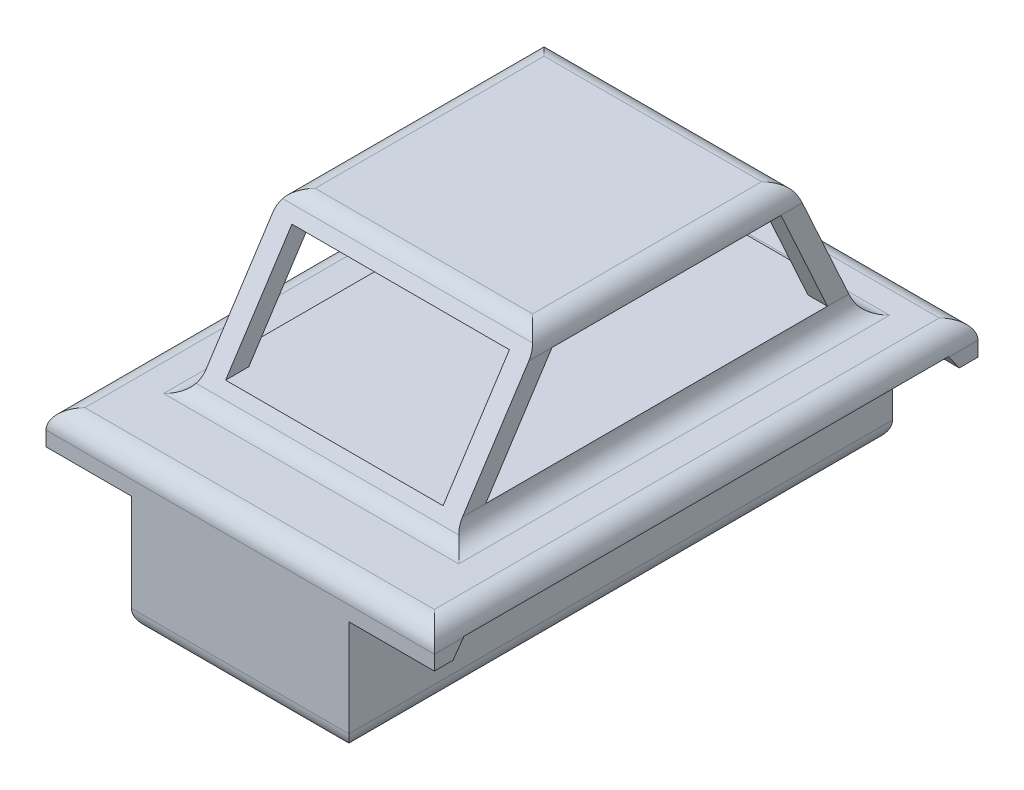
from build123d import *

# Parameters (mm, degrees)
SKETCH1_W           = 200
SKETCH1_H           = 150
BOSS_EXTRUDE1_DEPTH = 280
SKETCH2_W           = 44
SKETCH2_H           = 60
SKETCH2_W_2         = 34
SKETCH2_H_2         = 72.5
CUT_EXTRUDE1_DEPTH  = 280
CUT_EXTRUDE5_DEPTH  = 200
CUT_EXTRUDE8_DEPTH  = 44
CUT_EXTRUDE9_DEPTH  = 44
SKETCH6_W           = 112
SKETCH6_H           = 52.5
CUT_EXTRUDE7_DEPTH  = 280
FILLET1_START       = -100
FILLET1_DEPTH       = 200
FILLET1_START_2     = -76
FILLET1_2_DEPTH     = 10
FILLET1_START_3     = 66
FILLET1_3_DEPTH     = 10
FILLET1_START_4     = -66
FILLET1_4_DEPTH     = 132
FILLET1_START_5     = -281
FILLET1_5_DEPTH     = 282


with BuildPart() as part:
    # Sketch1 → Boss-Extrude1 (new body)
    with BuildSketch(Plane.XY):
        Rectangle(SKETCH1_W, SKETCH1_H)
    extrude(amount=-BOSS_EXTRUDE1_DEPTH)

    # Sketch2 → Cut-Extrude1 (cut)
    with BuildSketch(Plane.XY):
        with Locations((78, -45)):
            Rectangle(SKETCH2_W, SKETCH2_H)
        with Locations((-78, -45)):
            Rectangle(SKETCH2_W, SKETCH2_H)
        with Locations((83, 38.75)):
            Rectangle(SKETCH2_W_2, SKETCH2_H_2)
        with Locations((-83, 38.75)):
            Rectangle(SKETCH2_W_2, SKETCH2_H_2)
    extrude(amount=-CUT_EXTRUDE1_DEPTH, mode=Mode.SUBTRACT)

    # Sketch3 → Cut-Extrude5 (cut)
    with BuildSketch(Plane.ZY.offset(100)):
        Polygon((-280, 2.5), (-274.399041425, 2.5), (-252, 2.5), (-218.971094498, 75), (-280, 75), align=None)
        Polygon((-236.455453487, 12.5), (-168.766953205, 12.5), (-60.438488841, 12.5), (-94.602997447, 65), (-144.84946991, 65), (-212.537970192, 65), align=None)
        Polygon((-89.179559504, 75), (-42, 2.5), (-5.600958575, 2.5), (0, 2.5), (0, 75), align=None)
    extrude(amount=-CUT_EXTRUDE5_DEPTH, mode=Mode.SUBTRACT)

    # Sketch5 → Cut-Extrude8 (cut)
    with BuildSketch(Plane.ZY.offset(100)):
        Polygon((-264.773291637, -7.125749789), (-270.374250211, -15), (-140, -15), (-140, -7.125749789), align=None)
        Polygon((-15.226708363, -7.125749789), (-140, -7.125749789), (-140, -15), (-9.625749789, -15), align=None)
    extrude(amount=-CUT_EXTRUDE8_DEPTH, mode=Mode.SUBTRACT)

    # Sketch7 → Cut-Extrude9 (cut)
    with BuildSketch(Plane(origin=(100, 0, 0), x_dir=(0, 0, -1), z_dir=(1, 0, 0))):
        Polygon((9.625749789, -15), (15.226708363, -7.125749789), (264.773291637, -7.125749789), (270.374250211, -15), align=None)
    extrude(amount=-CUT_EXTRUDE9_DEPTH, mode=Mode.SUBTRACT)

    # Sketch6 → Cut-Extrude7 (cut)
    with BuildSketch(Plane.XY):
        with Locations((0, 38.75)):
            Rectangle(SKETCH6_W, SKETCH6_H)
    extrude(amount=-CUT_EXTRUDE7_DEPTH, mode=Mode.SUBTRACT)

    # Fillet1: read off the stored shape, not the designer's step
    # Fillet1 outline → Fillet1 (cut)
    with BuildSketch(Plane.YZ.offset(FILLET1_START)):
        with BuildLine():
            Line((-75, 0), (-75, -10))
            ThreePointArc((-75, -10), (-72.071067812, -2.928932188), (-65, 0))
            Line((-65, 0), (-75, 0))
        make_face()
        with BuildLine():
            ThreePointArc((-65, -280), (-72.071067812, -277.071067812), (-75, -270))
            Line((-75, -270), (-75, -280))
            Line((-75, -280), (-65, -280))
        make_face()
        with BuildLine():
            Line((2.5, 0), (-7.5, 0))
            ThreePointArc((-7.5, 0), (-0.428932188, -2.928932188), (2.5, -10))
            Line((2.5, -10), (2.5, 0))
        make_face()
        with BuildLine():
            ThreePointArc((2.5, -270), (-0.428932188, -277.071067812), (-7.5, -280))
            Line((-7.5, -280), (2.5, -280))
            Line((2.5, -280), (2.5, -270))
        make_face()
        with BuildLine():
            Line((75, -89.179559504), (70.454316835, -86.221444616))
            ThreePointArc((70.454316835, -86.221444616), (73.790425711, -89.835564613), (75, -94.602997447))
            Line((75, -94.602997447), (75, -89.179559504))
        make_face()
        with BuildLine():
            ThreePointArc((75, -212.537970192), (73.410042611, -217.948255145), (69.145763344, -221.638115591))
            Line((69.145763344, -221.638115591), (75, -218.971094498))
            Line((75, -218.971094498), (75, -212.537970192))
        make_face()
    extrude(amount=FILLET1_DEPTH, mode=Mode.SUBTRACT)

    # Fillet1 2 outline → Fillet1 2 (add)
    with BuildSketch(Plane.YZ.offset(FILLET1_START_2)):
        with BuildLine():
            ThreePointArc((7.045683165, -44.958114888), (3.709574289, -41.343994891), (2.5, -36.576562057))
            Line((2.5, -36.576562057), (2.5, -258.433124306))
            ThreePointArc((2.5, -258.433124306), (4.089957389, -253.022839352), (8.354236656, -249.332978906))
            Line((8.354236656, -249.332978906), (69.145763344, -221.638115591))
            ThreePointArc((69.145763344, -221.638115591), (73.410042611, -217.948255145), (75, -212.537970192))
            Line((75, -212.537970192), (75, -94.602997447))
            ThreePointArc((75, -94.602997447), (73.790425711, -89.835564613), (70.454316835, -86.221444616))
            Line((70.454316835, -86.221444616), (7.045683165, -44.958114888))
        make_face()
    extrude(amount=FILLET1_2_DEPTH)

    # Fillet1 3 outline → Fillet1 3 (add)
    with BuildSketch(Plane.YZ.offset(FILLET1_START_3)):
        with BuildLine():
            ThreePointArc((7.045683165, -44.958114888), (3.709574289, -41.343994891), (2.5, -36.576562057))
            Line((2.5, -36.576562057), (2.5, -258.433124306))
            ThreePointArc((2.5, -258.433124306), (4.089957389, -253.022839352), (8.354236656, -249.332978906))
            Line((8.354236656, -249.332978906), (69.145763344, -221.638115591))
            ThreePointArc((69.145763344, -221.638115591), (73.410042611, -217.948255145), (75, -212.537970192))
            Line((75, -212.537970192), (75, -94.602997447))
            ThreePointArc((75, -94.602997447), (73.790425711, -89.835564613), (70.454316835, -86.221444616))
            Line((70.454316835, -86.221444616), (7.045683165, -44.958114888))
        make_face()
    extrude(amount=FILLET1_3_DEPTH)

    # Fillet1 4 outline → Fillet1 4 (add)
    with BuildSketch(Plane.YZ.offset(FILLET1_START_4)):
        with BuildLine():
            ThreePointArc((7.045683165, -44.958114888), (3.709574289, -41.343994891), (2.5, -36.576562057))
            Line((2.5, -36.576562057), (2.5, -42))
            Line((2.5, -42), (7.045683165, -44.958114888))
        make_face()
        with BuildLine():
            Line((2.5, -252), (2.5, -258.433124306))
            ThreePointArc((2.5, -258.433124306), (4.089957389, -253.022839352), (8.354236656, -249.332978906))
            Line((8.354236656, -249.332978906), (2.5, -252))
        make_face()
    extrude(amount=FILLET1_4_DEPTH)

    # Fillet1 5 outline → Fillet1 5 (cut)
    with BuildSketch(Plane.XY.offset(FILLET1_START_5)):
        with BuildLine():
            ThreePointArc((56, 75), (63.071067812, 72.071067812), (66, 65))
            Line((66, 65), (66, 12.5))
            ThreePointArc((66, 12.5), (68.928932188, 5.428932188), (76, 2.5))
            Line((76, 2.5), (76, 75))
            Line((76, 75), (56, 75))
        make_face()
        with BuildLine():
            ThreePointArc((-66, 65), (-63.071067812, 72.071067812), (-56, 75))
            Line((-56, 75), (-76, 75))
            Line((-76, 75), (-76, 2.5))
            ThreePointArc((-76, 2.5), (-68.928932188, 5.428932188), (-66, 12.5))
            Line((-66, 12.5), (-66, 65))
        make_face()
        with BuildLine():
            Line((100, 2.5), (90, 2.5))
            ThreePointArc((90, 2.5), (97.071067812, -0.428932188), (100, -7.5))
            Line((100, -7.5), (100, 2.5))
        make_face()
        with BuildLine():
            Line((-90, 2.5), (-100, 2.5))
            Line((-100, 2.5), (-100, -7.5))
            ThreePointArc((-100, -7.5), (-97.071067812, -0.428932188), (-90, 2.5))
        make_face()
        with BuildLine():
            Line((56, -75), (56, -65))
            ThreePointArc((56, -65), (53.071067812, -72.071067812), (46, -75))
            Line((46, -75), (56, -75))
        make_face()
        with BuildLine():
            ThreePointArc((-46, -75), (-53.071067812, -72.071067812), (-56, -65))
            Line((-56, -65), (-56, -75))
            Line((-56, -75), (-46, -75))
        make_face()
    extrude(amount=FILLET1_5_DEPTH, mode=Mode.SUBTRACT)


solid = part.part
